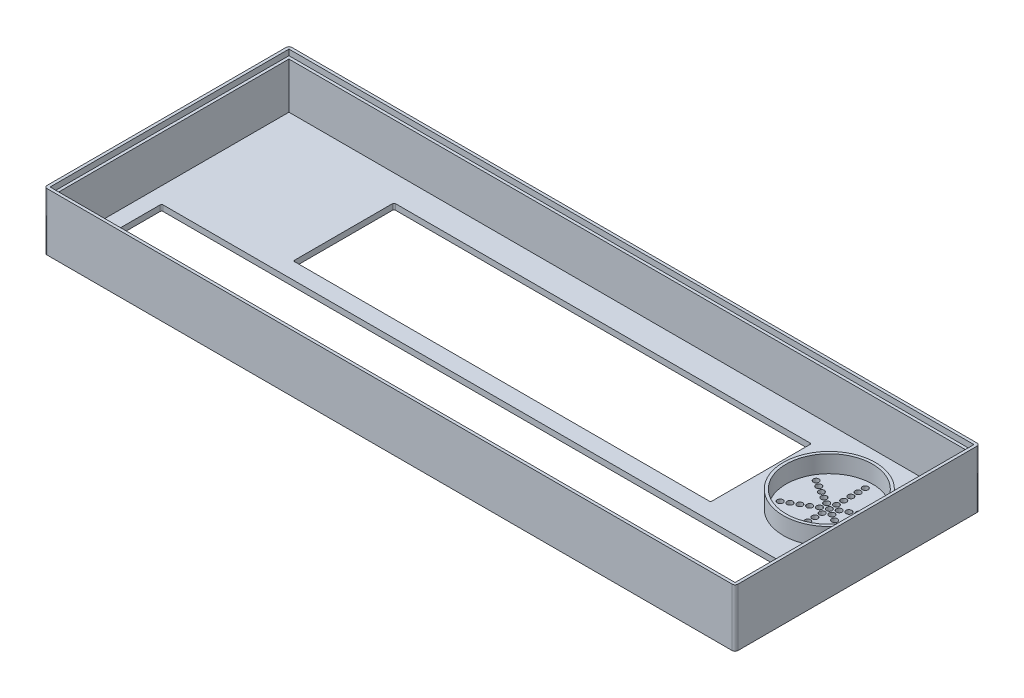
from build123d import *

# Parameters (mm, degrees)
SKETCH2_W               = 240
SKETCH2_H               = 85
BOSS_EXTRUDE1_DEPTH     = 20
SKETCH3_W               = 236
SKETCH3_H               = 81
CUT_EXTRUDE1_DEPTH      = 18
SKETCH4_W               = 238
SKETCH4_H               = 83
SKETCH4_W_2             = 236
SKETCH4_H_2             = 81
CUT_EXTRUDE2_DEPTH      = 2
SKETCH5_W               = 225
SKETCH5_H               = 21.5
SKETCH5_W_2             = 145
SKETCH5_H_2             = 35
CUT_EXTRUDE3_DEPTH      = 129.865239689
FILLET1_R               = 0.5
FILLET2_R               = 1
SKETCH8_R               = 16
SKETCH8_R_2             = 15
BOSS_EXTRUDE4_DEPTH     = 6
CUT_EXTRUDE5_DEPTH      = 10
CUT_EXTRUDE5_DEPTH_BACK = 129.570019834
SKETCH10_R              = 1
CUT_EXTRUDE6_START      = -1
CUT_EXTRUDE6_DEPTH      = 1


# Read off the part's stored shape, not the designer's step: Cut-Extrude6
with BuildPart() as part:
    # Sketch2 → Boss-Extrude1 (new body)
    with BuildSketch(Plane(origin=(0, 0, 0), x_dir=(1, 0, 0), z_dir=(0, 1, 0))):
        Rectangle(SKETCH2_W, SKETCH2_H)
    extrude(amount=BOSS_EXTRUDE1_DEPTH)

    # Sketch3 → Cut-Extrude1 (cut)
    with BuildSketch(Plane(origin=(0, 20, 0), x_dir=(1, 0, 0), z_dir=(0, 1, 0))):
        Rectangle(SKETCH3_W, SKETCH3_H)
    extrude(amount=-CUT_EXTRUDE1_DEPTH, mode=Mode.SUBTRACT)

    # Sketch4 → Cut-Extrude2 (cut)
    with BuildSketch(Plane(origin=(0, 20, 0), x_dir=(1, 0, 0), z_dir=(0, 1, 0))):
        Rectangle(SKETCH4_W, SKETCH4_H)
        Rectangle(SKETCH4_W_2, SKETCH4_H_2, mode=Mode.SUBTRACT)
    extrude(amount=-CUT_EXTRUDE2_DEPTH, mode=Mode.SUBTRACT)

    # Sketch5 → Cut-Extrude3 (cut, through all)
    with BuildSketch(Plane.XZ):
        with Locations((0, 20)):
            Rectangle(SKETCH5_W, SKETCH5_H)
        with Locations((0, -14)):
            Rectangle(SKETCH5_W_2, SKETCH5_H_2)
    extrude(amount=-CUT_EXTRUDE3_DEPTH, mode=Mode.SUBTRACT)

    # Fillet1
    fillet1_edges = [part.edges().sort_by_distance(p)[0] for p in [
        (-112.5, 1, 9.25),
        (-112.5, 1, 30.75),
        (112.5, 1, 30.75),
        (112.5, 1, 9.25),
        (-72.5, 1, -31.5),
        (-72.5, 1, 3.5),
        (72.5, 1, 3.5),
        (72.5, 1, -31.5),
    ]]
    fillet(fillet1_edges, radius=FILLET1_R)

    # Fillet2
    fillet2_edges = [part.edges().sort_by_distance(p)[0] for p in [
        (120, 10, 42.5),
        (-120, 10, 42.5),
        (-120, 10, -42.5),
        (120, 10, -42.5),
    ]]
    fillet(fillet2_edges, radius=FILLET2_R)

    # Sketch8 → Boss-Extrude4 (add)
    with BuildSketch(Plane(origin=(0, 2, 0), x_dir=(1, 0, 0), z_dir=(0, 1, 0))):
        with Locations(Location((95.25, 15, 0), (0, 0, 270))):
            Circle(SKETCH8_R)
        with Locations(Location((95.25, 15, 0), (0, 0, 270))):
            Circle(SKETCH8_R_2, mode=Mode.SUBTRACT)
    boss_extrude4 = extrude(amount=BOSS_EXTRUDE4_DEPTH)

    # Sketch10 → Cut-Extrude5 (cut, two sides: drawn at the far end of the back side and taken through both)
    with BuildSketch(Plane(origin=(0, 2, 0), x_dir=(1, 0, 0), z_dir=(0, 1, 0)).offset(-CUT_EXTRUDE5_DEPTH_BACK)):
        with Locations(Location((95.25, 15, 0), (0, 0, 270))):
            Circle(SKETCH10_R)
        with Locations(Location((97.415063509, 16.25, 0), (0, 0, 270))):
            Circle(SKETCH10_R)
        with Locations(Location((97.415063509, 13.75, 0), (0, 0, 270))):
            Circle(SKETCH10_R)
        with Locations(Location((99.580127019, 17.5, 0), (0, 0, 270))):
            Circle(SKETCH10_R)
        with Locations(Location((101.745190528, 18.75, 0), (0, 0, 270))):
            Circle(SKETCH10_R)
        with Locations(Location((103.910254038, 20, 0), (0, 0, 270))):
            Circle(SKETCH10_R)
        with Locations(Location((106.075317547, 21.25, 0), (0, 0, 270))):
            Circle(SKETCH10_R)
        with Locations(Location((95.25, 22.5, 0), (0, 0, 270))):
            Circle(SKETCH10_R)
        with Locations(Location((84.424682453, 21.25, 0), (0, 0, 270))):
            Circle(SKETCH10_R)
        with Locations(Location((86.589745962, 20, 0), (0, 0, 270))):
            Circle(SKETCH10_R)
        with Locations(Location((88.754809472, 18.75, 0), (0, 0, 270))):
            Circle(SKETCH10_R)
        with Locations(Location((90.919872981, 17.5, 0), (0, 0, 270))):
            Circle(SKETCH10_R)
        with Locations(Location((93.084936491, 16.25, 0), (0, 0, 270))):
            Circle(SKETCH10_R)
        with Locations(Location((95.25, 25, 0), (0, 0, 270))):
            Circle(SKETCH10_R)
        with Locations(Location((95.25, 27.5, 0), (0, 0, 270))):
            Circle(SKETCH10_R)
        with Locations(Location((95.25, 20, 0), (0, 0, 270))):
            Circle(SKETCH10_R)
        with Locations(Location((95.25, 17.5, 0), (0, 0, 270))):
            Circle(SKETCH10_R)
        with Locations(Location((93.084936491, 13.75, 0), (0, 0, 270))):
            Circle(SKETCH10_R)
        with Locations(Location((88.754809472, 11.25, 0), (0, 0, 270))):
            Circle(SKETCH10_R)
        with Locations(Location((90.919872981, 12.5, 0), (0, 0, 270))):
            Circle(SKETCH10_R)
        with Locations(Location((86.589745962, 10, 0), (0, 0, 270))):
            Circle(SKETCH10_R)
        with Locations(Location((84.424682453, 8.75, 0), (0, 0, 270))):
            Circle(SKETCH10_R)
        with Locations(Location((95.25, 12.5, 0), (0, 0, 270))):
            Circle(SKETCH10_R)
        with Locations(Location((95.25, 10, 0), (0, 0, 270))):
            Circle(SKETCH10_R)
        with Locations(Location((95.25, 7.5, 0), (0, 0, 270))):
            Circle(SKETCH10_R)
        with Locations(Location((95.25, 5, 0), (0, 0, 270))):
            Circle(SKETCH10_R)
        with Locations(Location((95.25, 2.5, 0), (0, 0, 270))):
            Circle(SKETCH10_R)
        with Locations(Location((99.580127019, 12.5, 0), (0, 0, 270))):
            Circle(SKETCH10_R)
        with Locations(Location((101.745190528, 11.25, 0), (0, 0, 270))):
            Circle(SKETCH10_R)
        with Locations(Location((103.910254038, 10, 0), (0, 0, 270))):
            Circle(SKETCH10_R)
        with Locations(Location((106.075317547, 8.75, 0), (0, 0, 270))):
            Circle(SKETCH10_R)
    extrude(amount=CUT_EXTRUDE5_DEPTH + CUT_EXTRUDE5_DEPTH_BACK, mode=Mode.SUBTRACT)

    # Mirror1: Boss-Extrude4 across plane
    add(boss_extrude4.mirror(Plane(origin=(0, 1, 0), x_dir=(0, 0, 1), z_dir=(0, -1, 0))))

    # Cut-Extrude6 outline → Cut-Extrude6 (cut)
    with BuildSketch(Plane.XZ.offset(CUT_EXTRUDE6_START)):
        with BuildLine():
            add(Edge.make_bspline(
                [(-108.15472288, -32.977527473), (-108.113686732, -32.978716917), (-108.037713422, -32.980919024), (-107.93296747, -33.002586606), (-107.847410058, -33.040203246), (-107.791669602, -33.086996082), (-107.758150433, -33.132133849), (-107.736140095, -33.172047907), (-107.719685445, -33.218900115), (-107.70281034, -33.270913712), (-107.692836067, -33.329806151), (-107.683913286, -33.394572419), (-107.679824119, -33.465759758), (-107.678973354, -33.515409975), (-107.678532404, -33.541143545)],
                knots=[0, 0, 0, 0, 0.142259221, 0.263375207, 0.368787486, 0.463416587, 0.511825226, 0.563337696, 0.62087762, 0.68383413, 0.752824696, 0.827680028, 0.910687038, 1, 1, 1, 1], degree=3))
            Line((-108.15472288, -32.977527473), (-108.15472288, -33.886195628))
            Line((-108.15472288, -33.886195628), (-107.678532404, -34.287051283))
            Line((-107.678532404, -34.287051283), (-107.678532404, -33.541143545))
        make_face()
        with BuildLine():
            add(Edge.make_bspline(
                [(-107.440437166, -33.567185211), (-107.441020229, -33.530281498), (-107.44214351, -33.459185875), (-107.449347693, -33.356661788), (-107.462060327, -33.262760787), (-107.480424111, -33.177420006), (-107.504772421, -33.100983621), (-107.532907623, -33.032447311), (-107.567832928, -32.973359208), (-107.607186303, -32.921728152), (-107.654012263, -32.878220348), (-107.70742138, -32.841059372), (-107.767677966, -32.809225081), (-107.834996649, -32.782965767), (-107.909851273, -32.764374126), (-107.99110238, -32.748888703), (-108.079852315, -32.740985005), (-108.141379569, -32.739962903), (-108.173324071, -32.739432235)],
                knots=[0, 0, 0, 0, 0.085794491, 0.165284526, 0.238774568, 0.305926631, 0.367926438, 0.425087436, 0.477745363, 0.527051095, 0.57549058, 0.625678659, 0.677910681, 0.733589355, 0.793201435, 0.856956787, 0.925733007, 1, 1, 1, 1], degree=3))
            Line((-107.440437166, -33.567185211), (-107.440437166, -34.287051283))
            Line((-107.440437166, -34.287051283), (-106.130913357, -34.287051283))
            Line((-106.130913357, -34.287051283), (-106.130913357, -33.819231342))
            add(Edge.make_bspline(
                [(-106.414581511, -32.649216461), (-106.390008821, -32.681906656), (-106.341136448, -32.746923851), (-106.280498912, -32.852696936), (-106.232446988, -32.964388776), (-106.199498175, -33.061906363), (-106.180312743, -33.146556286), (-106.165871682, -33.218038788), (-106.155490479, -33.297951615), (-106.145637792, -33.385959368), (-106.140092877, -33.482527976), (-106.133822426, -33.587264699), (-106.131499119, -33.700484043), (-106.131113691, -33.778618994), (-106.130913357, -33.819231342)],
                knots=[0, 0, 0, 0, 0.099663466, 0.198219655, 0.296401065, 0.395857856, 0.448671484, 0.507979696, 0.573627737, 0.645095085, 0.723899574, 0.809450731, 0.900957854, 1, 1, 1, 1], degree=3))
            add(Edge.make_bspline(
                [(-108.177974368, -32.08467033), (-108.119683214, -32.084915718), (-108.006471764, -32.085392303), (-107.841493659, -32.092270095), (-107.686418208, -32.102290363), (-107.541172895, -32.115878155), (-107.406136717, -32.134237885), (-107.281154736, -32.157674868), (-107.165907906, -32.184278132), (-107.059620487, -32.215076989), (-106.960777879, -32.250698086), (-106.867977427, -32.291627183), (-106.779478138, -32.337466525), (-106.696373078, -32.389007737), (-106.618756728, -32.446791127), (-106.544549867, -32.507608031), (-106.476850566, -32.575914617), (-106.435354048, -32.624763461), (-106.414581511, -32.649216461)],
                knots=[0, 0, 0, 0, 0.09115374, 0.177036244, 0.258178789, 0.334161553, 0.405127906, 0.471216515, 0.532958036, 0.590032567, 0.644171274, 0.697140238, 0.74853481, 0.799927096, 0.849867237, 0.899776773, 0.949829752, 1, 1, 1, 1], degree=3))
            add(Edge.make_bspline(
                [(-109.843710976, -32.488316164), (-109.80213157, -32.45449179), (-109.716540931, -32.384864779), (-109.566241061, -32.301993731), (-109.396386215, -32.233495394), (-109.241047861, -32.188319271), (-109.106076367, -32.157712636), (-108.995166221, -32.138603242), (-108.876988754, -32.121940057), (-108.751414096, -32.107801512), (-108.61829952, -32.097994482), (-108.478139364, -32.090593921), (-108.330535592, -32.085865298), (-108.22975123, -32.085075884), (-108.177974368, -32.08467033)],
                knots=[0, 0, 0, 0, 0.091765531, 0.188898093, 0.292855893, 0.405393531, 0.465883447, 0.530125786, 0.59831846, 0.670531123, 0.746779801, 0.827169569, 0.911210259, 1, 1, 1, 1], degree=3))
            add(Edge.make_bspline(
                [(-110.238056214, -33.736456045), (-110.237526031, -33.691503997), (-110.23650206, -33.604685659), (-110.233564909, -33.479026531), (-110.225404941, -33.363125199), (-110.217218873, -33.256858967), (-110.203288186, -33.160573975), (-110.18963667, -33.073328132), (-110.170615413, -32.996203542), (-110.143903616, -32.906205507), (-110.09809825, -32.803896824), (-110.028599613, -32.689954607), (-109.944932586, -32.582365909), (-109.877805442, -32.519994932), (-109.843710976, -32.488316164)],
                knots=[0, 0, 0, 0, 0.099357116, 0.191893812, 0.277713572, 0.356121324, 0.427341337, 0.492672349, 0.551168008, 0.602750769, 0.700006772, 0.79777068, 0.89728595, 1, 1, 1, 1], degree=3))
            Line((-110.238056214, -33.736456045), (-110.238056214, -35.775146521))
            Line((-110.238056214, -35.775146521), (-111.071389547, -35.775146521))
            Line((-111.071389547, -35.775146521), (-111.071389547, -36.489432235))
            Line((-111.071389547, -36.489432235), (-108.035675261, -36.489432235))
            Line((-108.035675261, -36.489432235), (-108.035675261, -35.775146521))
            Line((-108.035675261, -35.775146521), (-108.928532404, -35.775146521))
            Line((-108.928532404, -35.775146521), (-108.928532404, -33.541143545))
            add(Edge.make_bspline(
                [(-108.173324071, -32.739432235), (-108.206507615, -32.740013381), (-108.270172684, -32.741128351), (-108.362197418, -32.74832353), (-108.446354375, -32.761389478), (-108.523888018, -32.778434652), (-108.59300355, -32.802896174), (-108.655701516, -32.830736368), (-108.710858297, -32.863914846), (-108.758759495, -32.903899102), (-108.799346593, -32.951488574), (-108.834448494, -33.007865015), (-108.863464114, -33.073757504), (-108.887832845, -33.149146801), (-108.905911105, -33.233634233), (-108.918603996, -33.327853348), (-108.927128016, -33.431241625), (-108.928052816, -33.503612815), (-108.928532404, -33.541143545)],
                knots=[0, 0, 0, 0, 0.076840907, 0.147424928, 0.213518491, 0.273942286, 0.330924958, 0.382968369, 0.432583678, 0.479459259, 0.526799752, 0.576792723, 0.632698086, 0.693083492, 0.759967602, 0.83245341, 0.913112583, 1, 1, 1, 1], degree=3))
        make_face()
        with BuildLine():
            add(Edge.make_bspline(
                [(-110.952341928, -33.534633128), (-110.95196403, -33.487817491), (-110.951225472, -33.39632166), (-110.946088051, -33.262571015), (-110.93513388, -33.135822803), (-110.923175889, -33.015871812), (-110.904658281, -32.903153046), (-110.885179568, -32.797010094), (-110.859668093, -32.698099656), (-110.821585981, -32.575790986), (-110.762598101, -32.430773273), (-110.670346696, -32.26901813), (-110.561262594, -32.115529697), (-110.473960217, -32.024730271), (-110.429648476, -31.978643545)],
                knots=[0, 0, 0, 0, 0.083040079, 0.162292378, 0.237321102, 0.308672924, 0.376024428, 0.439868071, 0.500017161, 0.557062374, 0.667040962, 0.776853085, 0.886738153, 1, 1, 1, 1], degree=3))
            Line((-110.952341928, -33.534633128), (-110.952341928, -35.060860807))
            Line((-110.952341928, -35.060860807), (-111.785675261, -35.060860807))
            Line((-111.785675261, -35.060860807), (-111.785675261, -35.995570628))
            Line((-111.785675261, -35.995570628), (-111.309484785, -36.489432235))
            Line((-111.309484785, -36.489432235), (-111.309484785, -35.537051283))
            Line((-111.309484785, -35.537051283), (-110.476151452, -35.537051283))
            Line((-110.476151452, -35.537051283), (-110.476151452, -33.703903961))
            add(Edge.make_bspline(
                [(-110.042743714, -32.356247711), (-110.07931848, -32.395149181), (-110.151523822, -32.471947866), (-110.24297296, -32.599893103), (-110.318968991, -32.735063185), (-110.368182569, -32.855481366), (-110.40046202, -32.957850878), (-110.420676077, -33.042426619), (-110.436942109, -33.134474876), (-110.452216137, -33.233602755), (-110.463129071, -33.340696076), (-110.470211009, -33.455191094), (-110.474974751, -33.57706665), (-110.475751626, -33.660806504), (-110.476151452, -33.703903961)],
                knots=[0, 0, 0, 0, 0.109692774, 0.216553792, 0.322432958, 0.427912202, 0.483358252, 0.543040079, 0.606558111, 0.675526782, 0.749234949, 0.827810587, 0.911381193, 1, 1, 1, 1], degree=3))
            add(Edge.make_bspline(
                [(-108.281210976, -31.846575092), (-108.332064739, -31.846795847), (-108.431646419, -31.847228127), (-108.578281002, -31.8546372), (-108.719176824, -31.863089466), (-108.85477214, -31.877094155), (-108.984288146, -31.896047697), (-109.108885839, -31.916935683), (-109.227373864, -31.942996098), (-109.340301523, -31.972838731), (-109.447618805, -32.005988273), (-109.548974115, -32.044335735), (-109.644970354, -32.086095213), (-109.735764524, -32.131830318), (-109.821063058, -32.181604996), (-109.900440651, -32.236287669), (-109.975213052, -32.293102838), (-110.020444991, -32.335397182), (-110.042743714, -32.356247711)],
                knots=[0, 0, 0, 0, 0.081230686, 0.159065675, 0.234509797, 0.306707511, 0.376749581, 0.443598491, 0.508492384, 0.570480606, 0.630162451, 0.687839874, 0.743509002, 0.797332129, 0.850166326, 0.901131259, 0.951259072, 1, 1, 1, 1], degree=3))
            add(Edge.make_bspline(
                [(-106.570831511, -32.190697116), (-106.619920987, -32.161831365), (-106.720488993, -32.102695042), (-106.885035835, -32.030443456), (-107.065166555, -31.97248147), (-107.22531749, -31.933548594), (-107.362300824, -31.907917656), (-107.473361004, -31.891225113), (-107.591237127, -31.877361595), (-107.715959616, -31.866589502), (-107.847392244, -31.856966609), (-107.985710224, -31.85070297), (-108.131138756, -31.846862478), (-108.23036514, -31.846672461), (-108.281210976, -31.846575092)],
                knots=[0, 0, 0, 0, 0.096588903, 0.197878534, 0.304199258, 0.417391938, 0.477348022, 0.540672487, 0.60795842, 0.678745105, 0.753119062, 0.831602368, 0.913709258, 1, 1, 1, 1], degree=3))
            Line((-106.570831511, -32.190697116), (-107.153048773, -31.768450092))
            add(Edge.make_bspline(
                [(-108.528606809, -31.310860807), (-108.467460402, -31.312262287), (-108.345381888, -31.315060336), (-108.163840417, -31.338569902), (-107.983840365, -31.374364096), (-107.807197183, -31.426909643), (-107.633962137, -31.491922339), (-107.46621213, -31.569755252), (-107.305533177, -31.662387998), (-107.204029089, -31.732990209), (-107.153048773, -31.768450092)],
                knots=[0, 0, 0, 0, 0.124418364, 0.248400677, 0.372035619, 0.497638977, 0.623050376, 0.748398254, 0.8736333, 1, 1, 1, 1], degree=3))
            add(Edge.make_bspline(
                [(-110.429648476, -31.978643545), (-110.402592818, -31.953594899), (-110.347893936, -31.902953628), (-110.260913066, -31.830894567), (-110.165882645, -31.76557072), (-110.066807346, -31.701433134), (-109.960028993, -31.64379723), (-109.848939074, -31.586879906), (-109.730046682, -31.537802359), (-109.565038062, -31.473538646), (-109.349284481, -31.408502542), (-109.082477473, -31.351406161), (-108.807897122, -31.317188467), (-108.622328148, -31.312984177), (-108.528606809, -31.310860807)],
                knots=[0, 0, 0, 0, 0.05364126, 0.108447445, 0.164131882, 0.221314142, 0.280061695, 0.340574753, 0.402819591, 0.467066742, 0.59818535, 0.730083613, 0.863679123, 1, 1, 1, 1], degree=3))
        make_face()
        Polygon((-102.31487913, -31.965622711), (-102.946389547, -31.489432235), (-105.892818118, -31.489432235), (-105.892818118, -32.389729854), (-105.416627642, -32.918003664), (-105.416627642, -31.965622711), align=None)
        Polygon((-99.940437166, -31.965622711), (-97.083294309, -31.965622711), (-97.830132107, -31.489432235), (-100.416627642, -31.489432235), (-100.416627642, -32.216738783), (-100.176672285, -32.745012592), (-99.940437166, -32.918003664), align=None)
        Polygon((-101.581992226, -31.965622711), (-100.786791333, -31.965622711), (-101.395980321, -31.489432235), (-101.879611273, -31.489432235), (-102.083294309, -31.965622711), (-102.083294309, -33.121884234), align=None)
        Polygon((-105.416627642, -36.489432235), (-105.416627642, -35.537051283), (-104.523770499, -35.537051283), (-104.523770499, -33.156098902), (-104.999960976, -33.156098902), (-104.999960976, -35.060860807), (-105.892818118, -35.060860807), (-105.892818118, -35.614246223), align=None)
        Polygon((-108.035675261, -35.537051283), (-108.690437166, -35.060860807), (-108.690437166, -35.537051283), align=None)
        Polygon((-97.738056214, -35.537051283), (-97.083294309, -35.537051283), (-97.738056214, -35.060860807), align=None)
        Polygon((-97.083294309, -35.775146521), (-97.976151452, -35.775146521), (-97.976151452, -32.918003664), (-97.083294309, -32.918003664), (-97.083294309, -32.203717949), (-99.702341928, -32.203717949), (-99.702341928, -32.918003664), (-99.047580023, -32.918003664), (-99.047580023, -35.666329557), (-100.661233297, -32.203717949), (-101.442483297, -32.203717949), (-102.976151452, -35.685860807), (-102.976151452, -32.918003664), (-102.321389547, -32.918003664), (-102.321389547, -32.203717949), (-105.178532404, -32.203717949), (-105.178532404, -32.918003664), (-104.285675261, -32.918003664), (-104.285675261, -35.775146521), (-105.178532404, -35.775146521), (-105.178532404, -36.489432235), (-102.14002794, -36.489432235), (-101.139283892, -34.05732658), (-100.037163357, -36.489432235), (-97.083294309, -36.489432235), align=None)
        Polygon((-99.285675261, -33.156098902), (-99.761865738, -33.156098902), (-99.761865738, -33.583926283), (-99.285675261, -34.64419414), align=None)
        Polygon((-100.30316038, -36.489432235), (-101.127193118, -34.655354854), (-101.37830919, -35.232921818), (-101.154164845, -35.723993247), align=None)
    extrude(amount=CUT_EXTRUDE6_DEPTH, mode=Mode.SUBTRACT)


solid = part.part
